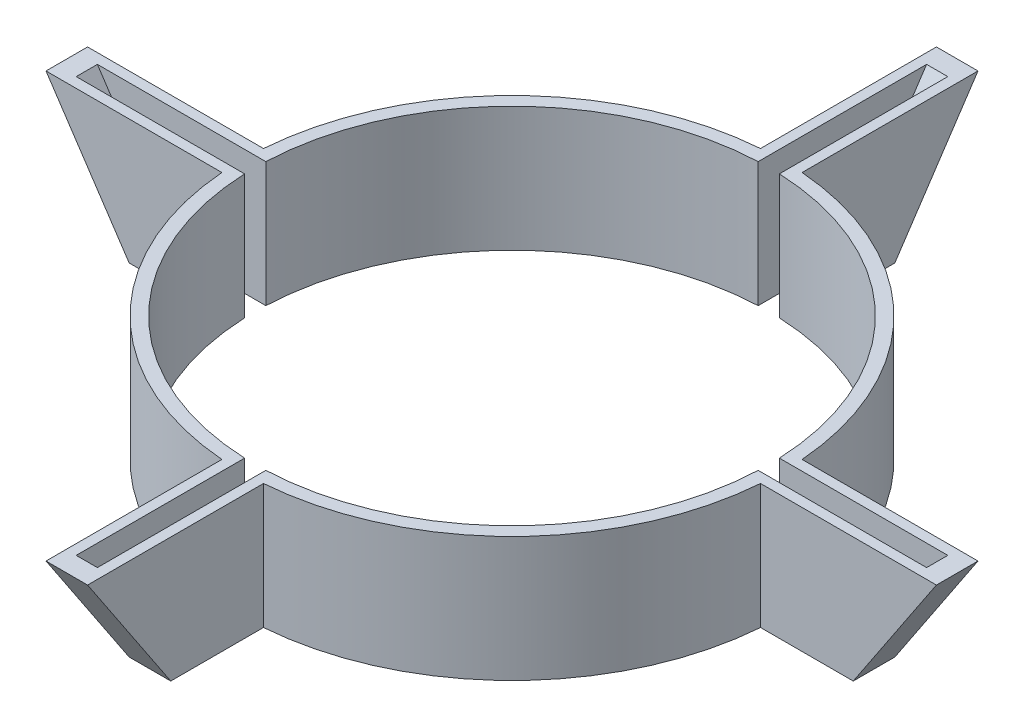
from build123d import *

# Parameters (mm, degrees)
SKETCH1_R                = 41.243
SKETCH1_R_2              = 39.243
BOSS_EXTRUDE1_DEPTH      = 57.15
BOSS_EXTRUDE2_REACH      = 135.912
BOSS_EXTRUDE2_END_RADIUS = 41.243
SKETCH4_W                = 6.35
SKETCH4_H                = 96.707907256
CUT_EXTRUDE1_REACH       = 160.512
CUT_EXTRUDE1_END_RADIUS  = 39.243
SKETCH5_W                = 3.2385
SKETCH5_H                = 66.566251295
CIRPATTERN1_COUNT        = 4
CUT_EXTRUDE2_DEPTH       = 153.219778824
CUT_EXTRUDE2_DEPTH_BACK  = 153.219778824
SKETCH6_W                = 189.773600596
SKETCH6_H                = 76.2
SKETCH6_H_2              = 57.15


with BuildPart() as part:
    # Sketch1 → Boss-Extrude1 (new, symmetric)
    with BuildSketch(Plane(origin=(0, 0, 0), x_dir=(1, 0, 0), z_dir=(0, 1, 0))):
        Circle(SKETCH1_R)
        Circle(SKETCH1_R_2, mode=Mode.SUBTRACT)
    extrude(amount=BOSS_EXTRUDE1_DEPTH, both=True)

    # Boss-Extrude2: up to this cylinder (the profile starts outside it)
    boss_extrude2_end = Plane(origin=(0, -4.217047, 0), z_dir=(0, -1, 0)) * Cylinder(BOSS_EXTRUDE2_END_RADIUS, 355.31, mode=Mode.PRIVATE)
    # Sketch4 → Boss-Extrude2 (add, up to the surface)
    with BuildSketch(Plane(origin=(0, -32.712086794, -49.068255488), x_dir=(1, 0, 0), z_dir=(0, 0.5546992156114064, 0.8320509480795576)), mode=Mode.PRIVATE) as boss_extrude2_sk1:
        with Locations((0, 34.246748735)):
            Rectangle(SKETCH4_W, SKETCH4_H)
    boss_extrude2_tool1 = extrude(boss_extrude2_sk1.sketch, amount=BOSS_EXTRUDE2_REACH, mode=Mode.PRIVATE) - boss_extrude2_end
    boss_extrude2 = boss_extrude2_tool1.solids().sort_by_distance((0, -4.217047, -68.0649))[0]
    add(boss_extrude2)

    # Cut-Extrude1: up to this cylinder (the profile starts outside it)
    cut_extrude1_end = Plane(origin=(0, 55.886966, 0), z_dir=(0, -1, 0)) * Cylinder(CUT_EXTRUDE1_END_RADIUS, 400.51, mode=Mode.PRIVATE)
    # Sketch5 → Cut-Extrude1 (cut, up to the surface)
    with BuildSketch(Plane(origin=(0, 68.727992713, -45.81854481), x_dir=(1, 0, 0), z_dir=(0, 0.8320509480795577, -0.5546992156114063)), mode=Mode.PRIVATE) as cut_extrude1_sk1:
        with Locations((0, 23.149531739)):
            Rectangle(SKETCH5_W, SKETCH5_H)
    cut_extrude1_tool1 = extrude(cut_extrude1_sk1.sketch, amount=-CUT_EXTRUDE1_REACH, mode=Mode.PRIVATE) - cut_extrude1_end
    cut_extrude1 = cut_extrude1_tool1.solids().sort_by_distance((0, 55.886966, -65.080135))[0]
    add(cut_extrude1, mode=Mode.SUBTRACT)

    # CirPattern1: Boss-Extrude2, Cut-Extrude1 ×4 about axis
    cirpattern1_axis = Axis((0, 57.15, 0), (0, -1, 0))
    add([boss_extrude2.rotate(cirpattern1_axis, i * 360 / CIRPATTERN1_COUNT) for i in range(1, CIRPATTERN1_COUNT)])
    add([cut_extrude1.rotate(cirpattern1_axis, i * 360 / CIRPATTERN1_COUNT) for i in range(1, CIRPATTERN1_COUNT)], mode=Mode.SUBTRACT)

    # Sketch6 → Cut-Extrude2 (cut, two sides: drawn at the far end of the back side and taken through both)
    with BuildSketch(Plane(origin=(0, 0, 0), x_dir=(0, 0, -1), z_dir=(1, 0, 0)).offset(-CUT_EXTRUDE2_DEPTH_BACK)):
        with Locations((0, 33.759942413)):
            Rectangle(SKETCH6_W, SKETCH6_H)
        with Locations((0, -51.965057587)):
            Rectangle(SKETCH6_W, SKETCH6_H_2)
    extrude(amount=CUT_EXTRUDE2_DEPTH + CUT_EXTRUDE2_DEPTH_BACK, mode=Mode.SUBTRACT)


solid = part.part
